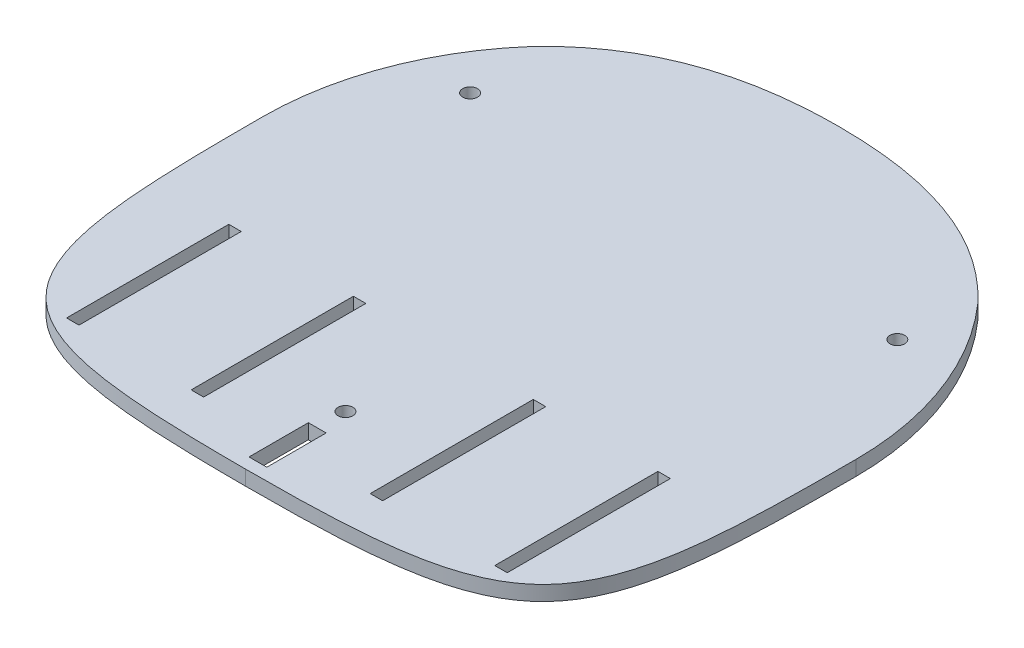
from build123d import *

# Parameters (mm, degrees)
BASE_DEPTH           = 6.35
EMPTYSPACETRIM_DEPTH = 185.858976792
SKETCH8_W            = 5.334
SKETCH8_H            = 69.446
SKETCH8_W_2          = 7.62
SKETCH8_H_2          = 25.4
SKETCH8_H_3          = 69.827
MOTORCUT_DEPTH       = 185.858976792
SKETCH11_R           = 3.175
SCREWCUT_DEPTH       = 185.858976792


with BuildPart() as part:
    # Sketch1 → Base (new body)
    with BuildSketch(Plane(origin=(0, 0, 0), x_dir=(1, 0, 0), z_dir=(0, 1, 0))):
        with BuildLine():
            ThreePointArc((127, 0), (0, 127), (-127, 0))
            add(Edge.make_bspline(
                [(-127, 0), (-127, -50.624671912), (-125.847104384, -127.403215469), (-59.089145197, -134.177191606), (0, -134.177191606)],
                knots=[0, 0, 0, 0, 0.496988082, 1, 1, 1, 1], degree=3))
            add(Edge.make_bspline(
                [(127, 0), (127, -50.624671912), (125.847104384, -127.403215469), (59.089145197, -134.177191606), (0, -134.177191606)],
                knots=[0, 0, 0, 0, 0.496988082, 1, 1, 1, 1], degree=3))
        make_face()
    extrude(amount=BASE_DEPTH)

    # Sketch16 → EmptySpaceTrim (cut, through all)
    with BuildSketch(Plane(origin=(0, 6.35, 0), x_dir=(1, 0, 0), z_dir=(0, 1, 0))):
        with BuildLine():
            Line((-95.26964052, 133.35), (-95.26964052, 83.980328621))
            add(Edge.make_bspline(
                [(-95.26964052, 83.980328621), (-69.156047903, 111.711202419), (-34.972901221, 119.822808394), (0, 119.822808394)],
                knots=[0, 0, 0, 0, 1, 1, 1, 1], degree=3))
            add(Edge.make_bspline(
                [(95.26964052, 83.980328621), (69.156047903, 111.711202419), (34.972901221, 119.822808394), (0, 119.822808394)],
                knots=[0, 0, 0, 0, 1, 1, 1, 1], degree=3))
            Line((95.26964052, 83.980328621), (95.26964052, 133.35))
            Line((95.26964052, 133.35), (-95.26964052, 133.35))
        make_face()
    extrude(amount=-EMPTYSPACETRIM_DEPTH, mode=Mode.SUBTRACT)

    # Sketch8 → MotorCut (cut, through all)
    with BuildSketch(Plane(origin=(0, 6.35, 0), x_dir=(1, 0, 0), z_dir=(0, 1, 0))):
        with Locations((-38.378348141, -81.74)):
            Rectangle(SKETCH8_W, SKETCH8_H)
        with Locations((0, -116.230204152)):
            Rectangle(SKETCH8_W_2, SKETCH8_H_2)
        with Locations((-91.718348141, -81.74)):
            Rectangle(SKETCH8_W, SKETCH8_H)
        with Locations((91.718348141, -81.6765)):
            Rectangle(SKETCH8_W, SKETCH8_H_3)
        with Locations((38.378348141, -81.6765)):
            Rectangle(SKETCH8_W, SKETCH8_H_3)
    extrude(amount=-MOTORCUT_DEPTH, mode=Mode.SUBTRACT)

    # Sketch11 → ScrewCut (cut, through all)
    with BuildSketch(Plane(origin=(0, 6.35, 0), x_dir=(1, 0, 0), z_dir=(0, 1, 0))):
        with Locations((0, -91.44)):
            Circle(SKETCH11_R)
        with Locations((-91.44, 53.34)):
            Circle(SKETCH11_R)
        with Locations((91.44, 53.34)):
            Circle(SKETCH11_R)
    extrude(amount=-SCREWCUT_DEPTH, mode=Mode.SUBTRACT)


solid = part.part
